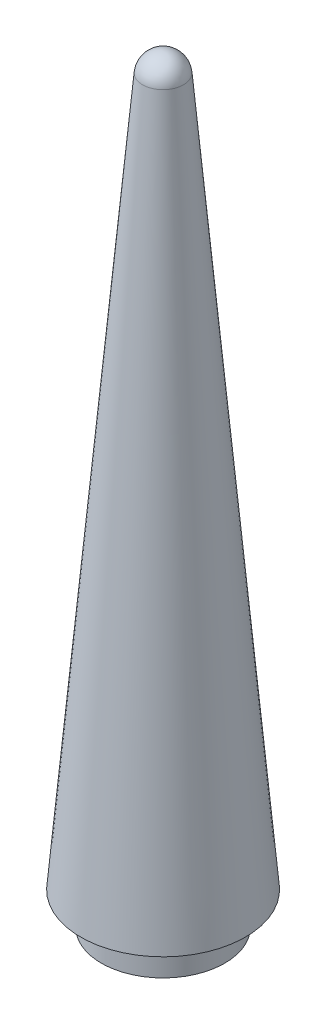
from build123d import *

# Parameters (mm, degrees)
F_1_4_20_TAPPED_HOLE1_D           = 5.1054
F_1_4_20_TAPPED_HOLE1_DEPTH       = 63.5
F_1_4_20_TAPPED_HOLE1_CSINK_D     = 7.62
F_1_4_20_TAPPED_HOLE1_CSINK_ANGLE = 90
F_1_4_20_TAPPED_HOLE1_TIP         = 1.533816902


with BuildPart() as part:
    # Sketch2 → Revolve1 (revolve)
    with BuildSketch(Plane.XY):
        with BuildLine():
            Line((0, 108.319151415), (0, -3.727096769))
            Line((0, -3.727096769), (0, -8.807096769))
            Line((0, -8.807096769), (9.525, -8.807096769))
            Line((9.525, -8.807096769), (9.525, -3.727096769))
            Line((9.525, -3.727096769), (12.712127984, -3.727096769))
            Line((12.712127984, -3.727096769), (3.162918166, 105.420870898))
            ThreePointArc((3.162918166, 105.420870898), (2.144998909, 107.485006959), (0, 108.319151415))
        make_face()
    revolve(axis=Axis((0, -3.727096769, 0), (0, 1, 0)))

    # 1/4-20 Tapped Hole1
    with Locations(Plane.XZ.offset(8.807096769)):
        with Locations((0, 0)):
            CounterSinkHole(F_1_4_20_TAPPED_HOLE1_D / 2, F_1_4_20_TAPPED_HOLE1_CSINK_D / 2, depth=F_1_4_20_TAPPED_HOLE1_DEPTH, counter_sink_angle=F_1_4_20_TAPPED_HOLE1_CSINK_ANGLE)
            with Locations((0, 0, -(F_1_4_20_TAPPED_HOLE1_DEPTH + F_1_4_20_TAPPED_HOLE1_TIP / 2))):  # 118° drill point
                Cone(0, F_1_4_20_TAPPED_HOLE1_D / 2, F_1_4_20_TAPPED_HOLE1_TIP, mode=Mode.SUBTRACT)


solid = part.part
